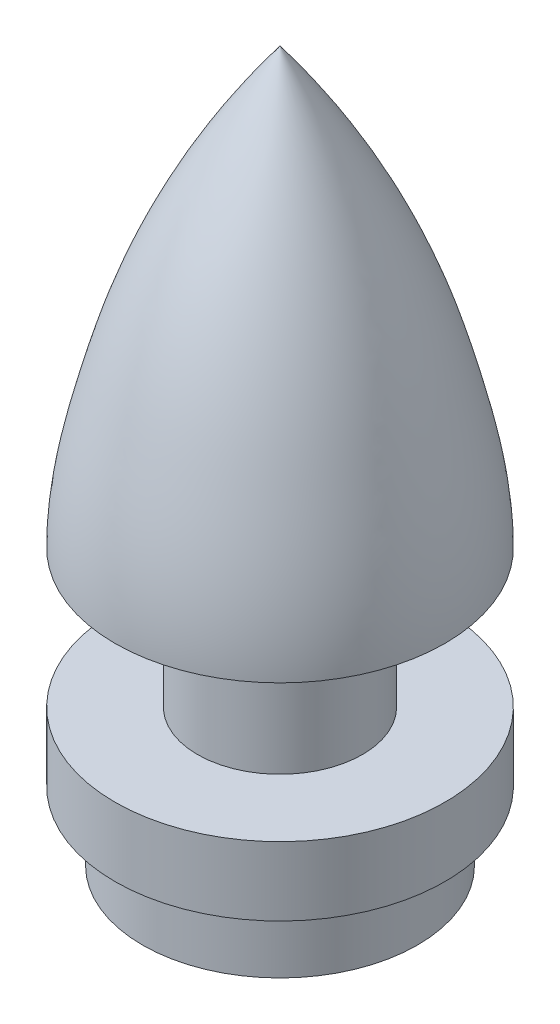
from build123d import *

# Parameters (mm, degrees)
SKETCH_2_R          = 1.5
CUT_EXTRUDE_1_DEPTH = 8


with BuildPart() as part:
    # 草圖1 → 旋轉1 (revolve)
    with BuildSketch(Plane.XY):
        with BuildLine():
            Line((0, 0), (5, 0))
            Line((5, 0), (5, 2.5))
            Line((5, 2.5), (6, 2.5))
            Line((6, 2.5), (6, 5))
            Line((6, 5), (3, 5))
            Line((3, 5), (3, 10))
            Line((3, 10), (6, 10))
            add(Edge.make_bspline(
                [(6, 10), (6, 11.790123817), (5.473282547, 14.083231805), (3.961053636, 19.501160151), (2.107898634, 22.999636316), (0, 25.813676606)],
                knots=[0, 0, 0, 0, 0.308621107, 0.408621107, 1, 1, 1, 1], degree=3))
            Line((0, 25.813676606), (0, 0))
        make_face()
    revolve(axis=Axis((0, 61.374215744, 0), (0, -1, 0)))

    # 草圖2 → 除料-伸長1 (cut)
    with BuildSketch(Plane.XZ):
        Circle(SKETCH_2_R)
    extrude(amount=-CUT_EXTRUDE_1_DEPTH, mode=Mode.SUBTRACT)


solid = part.part
